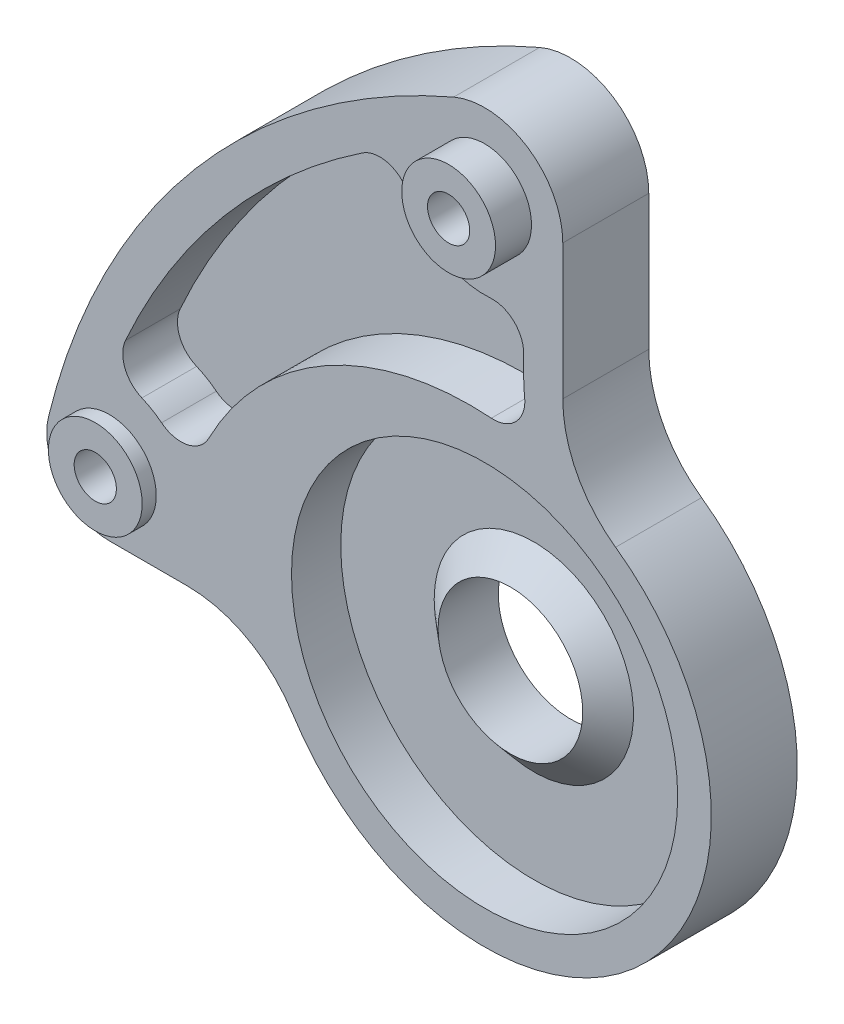
from build123d import *

# Parameters (mm, degrees)
BOSS_EXTRUDE1_DEPTH = 5.5
SKETCH2_R           = 3
BOSS_EXTRUDE2_DEPTH = 2.3
SKETCH3_R           = 3
BOSS_EXTRUDE3_DEPTH = 0.9
SKETCH4_R           = 4.625
CUT_EXTRUDE1_DEPTH  = 44.230082119
SKETCH5_R           = 1.35
CUT_EXTRUDE2_DEPTH  = 44.230082119
SKETCH7_R           = 12.35
CUT_EXTRUDE4_DEPTH  = 3.15
CUT_EXTRUDE5_DEPTH  = 3.5
SKETCH9_R           = 6.375
SKETCH9_R_2         = 4.625
BOSS_EXTRUDE4_DEPTH = 1.5
CHAMFER1_SIZE2      = 1.75
CHAMFER1_SIZE       = 1.5


with BuildPart() as part:
    # Sketch1 → Boss-Extrude1 (new body)
    with BuildSketch(Plane.XY.offset(5.5)):
        with BuildLine():
            Line((5, 18.364367672), (5, 27))
            ThreePointArc((5, 27), (2.748443387, 31.176847968), (-1.978423579, 31.591932071))
            ThreePointArc((-1.978423579, 31.591932071), (-18.536483892, 19.318360138), (-27.885598891, 0.94980064))
            ThreePointArc((-27.885598891, 0.94980064), (-27.146363183, -2.469898524), (-24, -4))
            Line((-24, -4), (-19.032866311, -4))
            ThreePointArc((-19.032866311, -4), (-15.168499178, -4.995239714), (-12.265624956, -7.733333333))
            ThreePointArc((-12.265624956, -7.733333333), (9.975316712, -10.523452689), (8.377777778, 11.834814722))
            ThreePointArc((8.377777778, 11.834814722), (5.894446616, 14.688621338), (5, 18.364367672))
        make_face()
    extrude(amount=-BOSS_EXTRUDE1_DEPTH)

    # Sketch2 → Boss-Extrude2 (add)
    with BuildSketch(Plane.XY.offset(5.5)):
        with Locations((0, 27)):
            Circle(SKETCH2_R)
    extrude(amount=BOSS_EXTRUDE2_DEPTH)

    # Sketch3 → Boss-Extrude3 (add)
    with BuildSketch(Plane.XY.offset(5.5)):
        with Locations((-24, 0)):
            Circle(SKETCH3_R)
    extrude(amount=BOSS_EXTRUDE3_DEPTH)

    # Sketch4 → Cut-Extrude1 (cut, through all)
    with BuildSketch(Plane(origin=(0, 0, 0), x_dir=(-1, 0, 0), z_dir=(0, 0, -1))):
        with Locations(Location((0, 0, 0), (0, 0, 180))):
            Circle(SKETCH4_R)
    extrude(amount=-CUT_EXTRUDE1_DEPTH, mode=Mode.SUBTRACT)

    # Sketch5 → Cut-Extrude2 (cut, through all)
    with BuildSketch(Plane.XY.offset(7.8)):
        with Locations(Location((0, 27, 0), (0, 0, 180))):
            Circle(SKETCH5_R)
        with Locations((-24, 0)):
            Circle(SKETCH5_R)
    extrude(amount=-CUT_EXTRUDE2_DEPTH, mode=Mode.SUBTRACT)

    # Sketch7 → Cut-Extrude4 (cut)
    with BuildSketch(Plane.XY.offset(5.5)):
        with Locations(Location((0, 0, 0), (0, 0, 180))):
            Circle(SKETCH7_R)
    extrude(amount=-CUT_EXTRUDE4_DEPTH, mode=Mode.SUBTRACT)

    # Sketch8 → Cut-Extrude5 (cut)
    with BuildSketch(Plane.XY.offset(5.5)):
        with BuildLine():
            Line((2.5, 18.364367672), (2.5, 19.640321115))
            ThreePointArc((2.5, 19.640321115), (1.865443882, 21.101677678), (0.364436994, 21.635721494))
            ThreePointArc((0.364436994, 21.635721494), (-2.746191158, 22.377583712), (-4.885348815, 24.754634735))
            ThreePointArc((-4.885348815, 24.754634735), (-6.159449386, 25.844240566), (-7.815189176, 25.581373906))
            ThreePointArc((-7.815189176, 25.581373906), (-16.658270057, 17.667681565), (-22.968564749, 7.617468292))
            ThreePointArc((-22.968564749, 7.617468292), (-23.002979343, 6.066010594), (-21.917514319, 4.956970002))
            ThreePointArc((-21.917514319, 4.956970002), (-21.262726036, 4.627702396), (-20.658800912, 4.212444287))
            ThreePointArc((-20.658800912, 4.212444287), (-18.994988647, 3.824188919), (-17.638370065, 4.862745371))
            ThreePointArc((-17.638370065, 4.862745371), (-10.125827676, 12.648544298), (0.431762956, 15.013758475))
            ThreePointArc((0.431762956, 15.013758475), (2.014294705, 15.621352145), (2.561932671, 17.225618165))
            ThreePointArc((2.561932671, 17.225618165), (2.5154946, 17.794151464), (2.5, 18.364367672))
        make_face()
    extrude(amount=-CUT_EXTRUDE5_DEPTH, mode=Mode.SUBTRACT)

    # Sketch9 → Boss-Extrude4 (add)
    with BuildSketch(Plane.XY.offset(2.35)):
        with Locations(Location((0, 0, 0), (0, 0, 180))):
            Circle(SKETCH9_R)
        Circle(SKETCH9_R_2, mode=Mode.SUBTRACT)
    extrude(amount=BOSS_EXTRUDE4_DEPTH)

    # Chamfer1
    chamfer1_edges = [part.edges().sort_by_distance(p)[0] for p in [
        (6.375, 0, 3.85),
    ]]
    chamfer1_side = [part.faces().sort_by_distance(p)[0] for p in [
        (6.375, 0, 3.82),
    ]]
    chamfer(chamfer1_edges, length=CHAMFER1_SIZE - 0.0001, length2=CHAMFER1_SIZE2 - 0.0001, reference=chamfer1_side[0])  # a hair under: the kernel refuses the full size


solid = part.part
